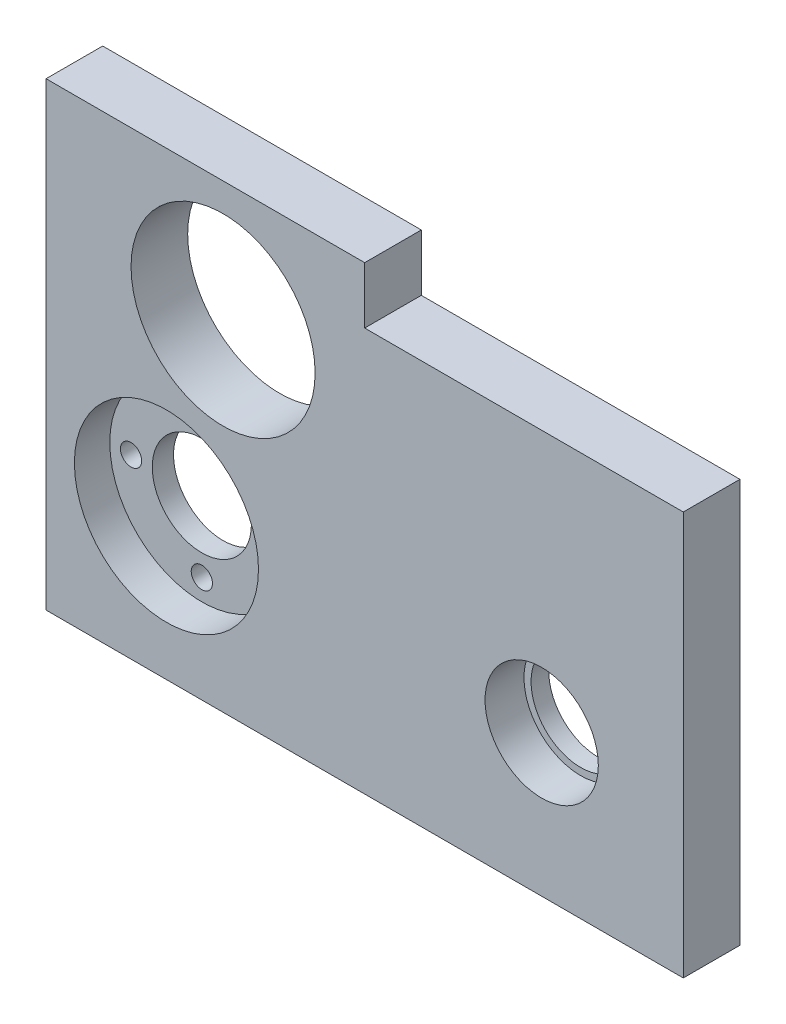
from build123d import *

# Parameters (mm, degrees)
ESQUISSE1_W             = 90
ESQUISSE1_H             = 65
ESQUISSE1_R             = 7
ESQUISSE1_R_2           = 13
BOSS_EXTRU_1_DEPTH      = 8
ESQUISSE2_R             = 13
BOSS_EXTRU_2_DEPTH      = 3
ESQUISSE3_R             = 7
ESQUISSE3_R_2           = 1.5
ENL_V_MAT_EXTRU_1_DEPTH = 112.130553854
ESQUISSE4_R             = 8
ENL_V_MAT_EXTRU_2_DEPTH = 5.5
ESQUISSE5_W             = 45
ESQUISSE5_H             = 8
ENL_V_MAT_EXTRU_3_DEPTH = 112.30588484
ESQUISSE6_R             = 1.65
ENL_V_MAT_EXTRU_4_DEPTH = 10


with BuildPart() as part:
    # Esquisse1 → Boss.-Extru.1 (new body)
    with BuildSketch(Plane.XY):
        with Locations((45, 32.5)):
            Rectangle(ESQUISSE1_W, ESQUISSE1_H)
        with Locations((70, 20)):
            Circle(ESQUISSE1_R, mode=Mode.SUBTRACT)
        with Locations((17, 20)):
            Circle(ESQUISSE1_R_2, mode=Mode.SUBTRACT)
        with Locations((25, 48)):
            Circle(ESQUISSE1_R_2, mode=Mode.SUBTRACT)
    extrude(amount=BOSS_EXTRU_1_DEPTH)

    # Esquisse2 → Boss.-Extru.2 (add)
    with BuildSketch(Plane(origin=(0, 0, 0), x_dir=(-1, 0, 0), z_dir=(0, 0, -1))):
        with Locations((-17, 20)):
            Circle(ESQUISSE2_R)
    extrude(amount=-BOSS_EXTRU_2_DEPTH)

    # Esquisse3 → Enlèv. mat.-Extru.1 (cut, through all)
    with BuildSketch(Plane.XY.offset(3)):
        with Locations((17, 20)):
            Circle(ESQUISSE3_R)
        with Locations((27, 20)):
            Circle(ESQUISSE3_R_2)
        with Locations((17, 10)):
            Circle(ESQUISSE3_R_2)
        with Locations((7, 20)):
            Circle(ESQUISSE3_R_2)
        with Locations((17, 30)):
            Circle(ESQUISSE3_R_2)
    extrude(amount=-ENL_V_MAT_EXTRU_1_DEPTH, mode=Mode.SUBTRACT)

    # Esquisse4 → Enlèv. mat.-Extru.2 (cut)
    with BuildSketch(Plane.XY.offset(8)):
        with Locations((70, 20)):
            Circle(ESQUISSE4_R)
    extrude(amount=-ENL_V_MAT_EXTRU_2_DEPTH, mode=Mode.SUBTRACT)

    # Esquisse5 → Enlèv. mat.-Extru.3 (cut, through all)
    with BuildSketch(Plane.XY.offset(8)):
        with Locations((67.5, 61)):
            Rectangle(ESQUISSE5_W, ESQUISSE5_H)
    extrude(amount=-ENL_V_MAT_EXTRU_3_DEPTH, mode=Mode.SUBTRACT)

    # Esquisse6 → Enlèv. mat.-Extru.4 (cut)
    with BuildSketch(Plane.ZY):
        with Locations((4, 7)):
            Circle(ESQUISSE6_R)
        with Locations((4, 35)):
            Circle(ESQUISSE6_R)
    extrude(amount=-ENL_V_MAT_EXTRU_4_DEPTH, mode=Mode.SUBTRACT)


solid = part.part
